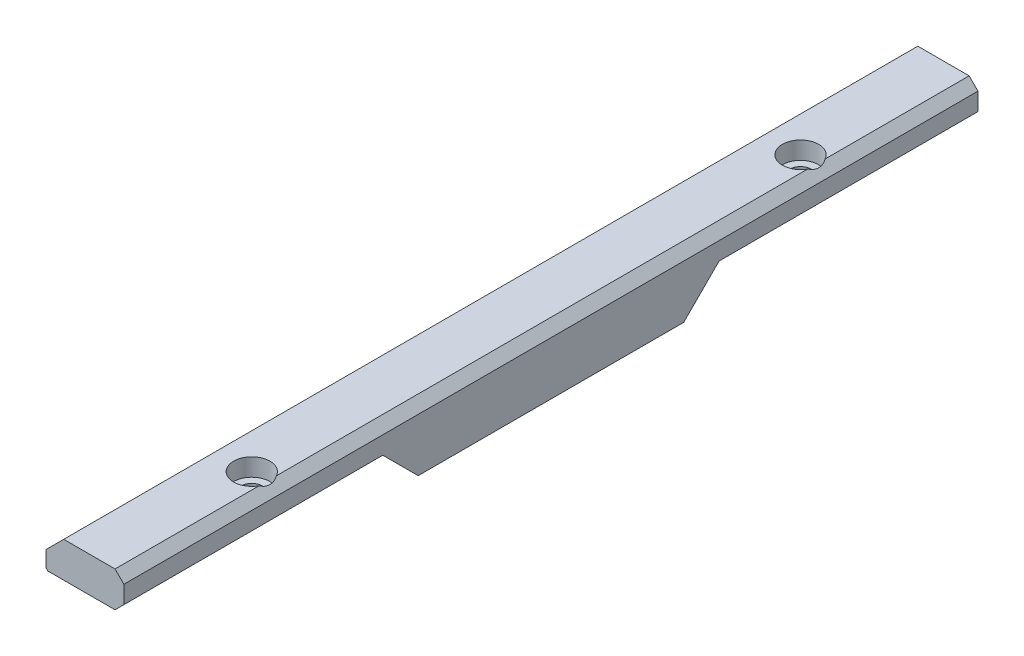
from build123d import *

# Parameters (mm, degrees)
EXTRUDE_1_DEPTH          = 96.5
CUT_EXTRUDE_1_DEPTH      = 97.93327602
CUT_EXTRUDE_1_DEPTH_BACK = 10
SKETCH_2_R               = 1.2
SKETCH_2_3_R             = 2.05
CUT_EXTRUDE_2_DEPTH      = 2
CHAMFER_3_SIZE           = 2
SKETCH_3_W               = 1.8
SKETCH_3_H               = 7.4
CUT_EXTRUDE_3_DEPTH      = 1.9
CHAMFER_4_SIZE           = 0.2
CHAMFER_5_SIZE           = 0.6
CHAMFER_2_SIZE           = 1
SKETCH_4_W               = 1.3
SKETCH_4_H               = 30
EXTRUDE_2_DEPTH          = 3
CHAMFER_6_SIZE           = 3
CHAMFER_1_SIZE           = 1
CHAMFER_7_SIZE           = 0.4


# Some blends are built 0.0001 mm under size
with BuildPart() as part:
    # 草图1 → 凸台-拉伸1 (new body)
    with BuildSketch(Plane.XY):
        Polygon((0, 0), (7, 0), (7, 4), (0, 4), (-1.8, 4), (-1.8, -1.9), (0, -1.9), align=None)
    extrude(amount=-EXTRUDE_1_DEPTH)

    # 草图2 → 切除-拉伸1 (cut, two sides: drawn at the far end of the back side and taken through both)
    with BuildSketch(Plane(origin=(0, 4, 0), x_dir=(1, 0, 0), z_dir=(0, 1, 0)).offset(-CUT_EXTRUDE_1_DEPTH_BACK)):
        with Locations(Location((4.2, 79.25, 0), (0, 0, 90))):
            Circle(SKETCH_2_R)
        with Locations(Location((4.2, 17.25, 0), (0, 0, 90))):
            Circle(SKETCH_2_R)
    extrude(amount=CUT_EXTRUDE_1_DEPTH + CUT_EXTRUDE_1_DEPTH_BACK, mode=Mode.SUBTRACT)

    # 草图2<3> → 切除-拉伸2 (cut)
    with BuildSketch(Plane(origin=(0, 4, 0), x_dir=(1, 0, 0), z_dir=(0, 1, 0))):
        with Locations(Location((4.2, 79.25, 0), (0, 0, 270))):
            Circle(SKETCH_2_3_R)
        with Locations(Location((4.2, 17.25, 0), (0, 0, 270))):
            Circle(SKETCH_2_3_R)
    extrude(amount=-CUT_EXTRUDE_2_DEPTH, mode=Mode.SUBTRACT)

    # 倒角3
    chamfer_3_edges = [part.edges().sort_by_distance(p)[0] for p in [
        (-1.8, 4, -48.25),
    ]]
    chamfer(chamfer_3_edges, length=CHAMFER_3_SIZE)

    # 草图3 → 切除-拉伸3 (cut)
    with BuildSketch(Plane.XZ.offset(1.9)):
        with Locations((-0.9, -92.8)):
            Rectangle(SKETCH_3_W, SKETCH_3_H)
        with Locations((-0.9, -3.7)):
            Rectangle(SKETCH_3_W, SKETCH_3_H)
    extrude(amount=-CUT_EXTRUDE_3_DEPTH, mode=Mode.SUBTRACT)

    # 倒角4
    chamfer_4_edges = [part.edges().sort_by_distance(p)[0] for p in [
        (-1.8, -1.9, -48.25),
        (0, -1.9, -48.25),
        (-1.8, -0.95, -89.1),
        (0, -0.95, -89.1),
        (-1.8, 0, -92.8),
        (-1.8, -0.95, -7.4),
        (0, -0.95, -7.4),
        (-1.8, 0, -3.7),
    ]]
    chamfer(chamfer_4_edges, length=CHAMFER_4_SIZE)

    # 倒角5
    # the kernel refuses this chamfer: 0.6 mm, written as the material it takes off along each edge
    with BuildSketch(Plane(origin=(1.343009793, -1.9, -89.1), x_dir=(0, 0.9996219169112965, -0.027495876610595982), z_dir=(-1, 0, 0))) as chamfer_5_piece_1:
        Polygon((CHAMFER_5_SIZE * 0.999621916911, -CHAMFER_5_SIZE * 0.0274958766106), (-CHAMFER_5_SIZE * 0.0274958766106, -CHAMFER_5_SIZE * 0.999621916911), (0, 0), align=None)
    extrude(amount=4.486019586, mode=Mode.SUBTRACT)
    with BuildSketch(Plane(origin=(1.343009793, -1.9, -7.4), x_dir=(0, 0.9996219169112968, 0.027495876610585925), z_dir=(-1, 0, 0))) as chamfer_5_piece_2:
        Polygon((CHAMFER_5_SIZE * 0.999621916911, CHAMFER_5_SIZE * 0.0274958766106), (-CHAMFER_5_SIZE * 0.0274958766106, CHAMFER_5_SIZE * 0.999621916911), (0, 0), align=None)
    extrude(amount=4.486019586, mode=Mode.SUBTRACT)

    # 倒角2
    # the kernel refuses this chamfer: 1 mm, written as the material it takes off along each edge
    with BuildSketch(Plane(origin=(7, 4, 2.571682988), x_dir=(-0.9996219169112968, 0.027495876610586487, 0), z_dir=(0, 0, -1))) as chamfer_2_piece_1:
        Polygon((CHAMFER_2_SIZE * 0.999621916911, -CHAMFER_2_SIZE * 0.0274958766106), (-CHAMFER_2_SIZE * 0.0274958766106, -CHAMFER_2_SIZE * 0.999621916911), (0, 0), align=None)
    extrude(amount=101.643365976, mode=Mode.SUBTRACT)

    # 草图4 → 凸台-拉伸2 (add)
    with BuildSketch(Plane(origin=(0, 0, 0), x_dir=(1, 0, 0), z_dir=(0, 1, 0))):
        with Locations((6.35, 48.25)):
            Rectangle(SKETCH_4_W, SKETCH_4_H)
    extrude(amount=-EXTRUDE_2_DEPTH)

    # 倒角6
    chamfer_6_edges = [part.edges().sort_by_distance(p)[0] for p in [
        (6.35, 0, -33.25),
        (6.35, 0, -63.25),
    ]]
    chamfer(chamfer_6_edges, length=CHAMFER_6_SIZE - 0.0001)  # a hair under: the kernel refuses the full size

    # 倒角1
    chamfer_1_edges = [part.edges().sort_by_distance(p)[0] for p in [
        (7, 0, -81.37495),
        (7, 0, -15.12505),
    ]]
    chamfer(chamfer_1_edges, length=CHAMFER_1_SIZE)

    # 倒角7
    chamfer_7_edges = [part.edges().sort_by_distance(p)[0] for p in [
        (5.7, -3, -48.25),
    ]]
    chamfer(chamfer_7_edges, length=CHAMFER_7_SIZE)


solid = part.part
